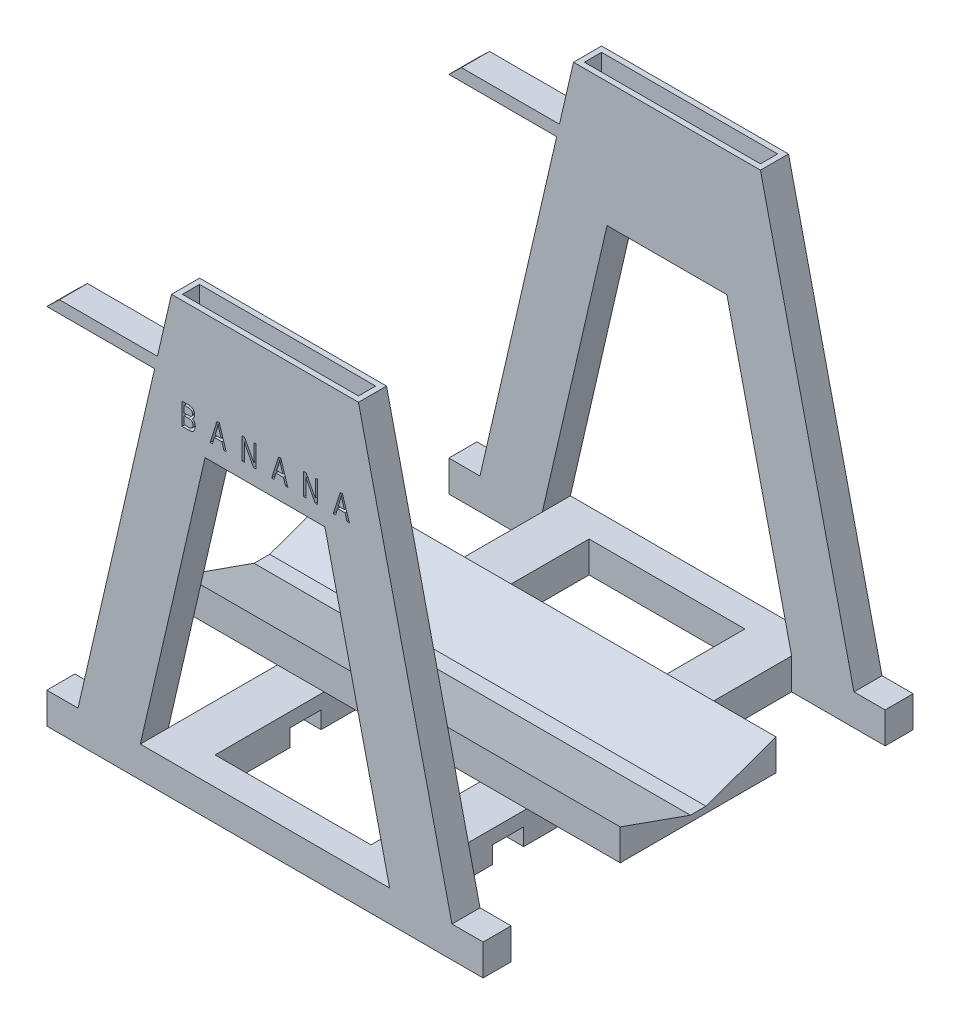
from build123d import *

# Parameters (mm, degrees)
BOSS_EXTRUDE1_DEPTH     = 9
SKETCH2_W               = 15
SKETCH2_H               = 10
BOSS_EXTRUDE2_DEPTH     = 120
SKETCH3_W               = 15
SKETCH3_H               = 10
BOSS_EXTRUDE3_DEPTH     = 9
SKETCH6_R               = 2
CUT_EXTRUDE3_DEPTH      = 226.264289225
SKETCH7_W               = 10
SKETCH7_H               = 5.5
CUT_EXTRUDE4_DEPTH      = 226.264289225
CUT_EXTRUDE5_DEPTH      = 209.671991412
WRAP1_DEPTH             = 2
WRAP2_START             = -2
WRAP2_DEPTH             = 2
BOSS_EXTRUDE6_START     = -70
BOSS_EXTRUDE6_OUTLINE_W = 3.897564783
BOSS_EXTRUDE6_OUTLINE_H = 9
BOSS_EXTRUDE6_DEPTH     = 35.502809866
CUT_EXTRUDE7_DEPTH      = 209.671991579
BOSS_EXTRUDE7_REACH     = 227.264
BOSS_EXTRUDE8_DEPTH     = 30
SKETCH19_W              = 56.5
SKETCH19_H              = 5.5
CUT_EXTRUDE9_DEPTH      = 25
SKETCH20_W              = 56.5
SKETCH20_H              = 5.5
CUT_EXTRUDE13_DEPTH     = 25


# Read off the part's stored shape, not the designer's step: Wrap1, Wrap2, Boss-Extrude6
with BuildPart() as part:
    # Sketch1 → Boss-Extrude1 (new body)
    with BuildSketch(Plane.XY):
        Polygon((-70, 0), (70, 0), (70, 10), (60, 10), (30, 140), (-30, 140), (-60, 10), (-70, 10), align=None)
    extrude(amount=BOSS_EXTRUDE1_DEPTH)

    # Sketch2 → Boss-Extrude2 (add)
    with BuildSketch(Plane.XY.offset(9)):
        with Locations((-32.5, 5)):
            Rectangle(SKETCH2_W, SKETCH2_H)
        with Locations((32.5, 5)):
            Rectangle(SKETCH2_W, SKETCH2_H)
    extrude(amount=BOSS_EXTRUDE2_DEPTH)

    # Sketch3 → Boss-Extrude3 (add)
    with BuildSketch(Plane.XY.offset(129)):
        Polygon((-25, 0), (70, 0), (70, 10), (60, 10), (30, 140), (-30, 140), (-60, 10), (-70, 10), (-70, 0), (-40, 0), (-40, 10), (-25, 10), align=None)
        with Locations((-32.5, 5)):
            Rectangle(SKETCH3_W, SKETCH3_H)
    extrude(amount=BOSS_EXTRUDE3_DEPTH)

    # Sketch6 → Cut-Extrude3 (cut, through all)
    with BuildSketch(Plane(origin=(40, 0, 0), x_dir=(0, 0, -1), z_dir=(1, 0, 0))):
        with Locations((-69, 5)):
            Circle(SKETCH6_R)
    extrude(amount=-CUT_EXTRUDE3_DEPTH, mode=Mode.SUBTRACT)

    # Sketch7 → Cut-Extrude4 (cut, through all)
    with BuildSketch(Plane(origin=(40, 0, 0), x_dir=(0, 0, -1), z_dir=(1, 0, 0))):
        with Locations((-38, 2.75)):
            Rectangle(SKETCH7_W, SKETCH7_H)
        with Locations((-100, 2.75)):
            Rectangle(SKETCH7_W, SKETCH7_H)
    extrude(amount=-CUT_EXTRUDE4_DEPTH, mode=Mode.SUBTRACT)

    # Sketch11 → Cut-Extrude5 (cut, through all)
    with BuildSketch(Plane.XY.offset(138)):
        Polygon((-40, 10), (40, 10), (19.230769231, 100), (-19.230769231, 100), align=None)
    extrude(amount=-CUT_EXTRUDE5_DEPTH, mode=Mode.SUBTRACT)

    # Wrap1 outline → Wrap1 (cut)
    # profile 1 of 6: a face of its own
    with BuildSketch(Plane(origin=(0, 0, 138), x_dir=(-1, 0, 0), z_dir=(0, 0, -1))):
        with BuildLine():
            Line((26.636363636, 112), (24.465909091, 112))
            add(Edge.make_bspline(
                [(24.465909091, 112), (24.412387075, 111.99961684), (24.308084537, 111.998870145), (24.155971868, 111.988392277), (24.01236608, 111.972961835), (23.877013252, 111.952268584), (23.750933524, 111.923725226), (23.633017031, 111.889788151), (23.523949716, 111.84855853), (23.389500433, 111.786579854), (23.234568973, 111.689336809), (23.065213144, 111.547084561), (22.917376343, 111.372957501), (22.785907176, 111.177315385), (22.678135608, 110.961409469), (22.60133372, 110.730947284), (22.554296617, 110.489122922), (22.548437341, 110.324077103), (22.545454545, 110.240056818)],
                knots=[0, 0, 0, 0, 0.054419901, 0.106052316, 0.154973079, 0.201283865, 0.245207579, 0.286348378, 0.325967571, 0.363667586, 0.436758257, 0.511236289, 0.587698946, 0.668228913, 0.750489374, 0.83225793, 0.914607129, 1, 1, 1, 1], degree=3))
            add(Edge.make_bspline(
                [(22.545454545, 110.240056818), (22.547820411, 110.162717247), (22.552466431, 110.01084), (22.591706687, 109.789343248), (22.656188718, 109.579438847), (22.745180341, 109.382599042), (22.857848847, 109.201013549), (22.992710329, 109.037889018), (23.148309744, 108.89208859), (23.266786112, 108.812817809), (23.326704545, 108.772727273)],
                knots=[0, 0, 0, 0, 0.133378671, 0.261925234, 0.386749065, 0.511436452, 0.633636329, 0.754357806, 0.87576851, 1, 1, 1, 1], degree=3))
            add(Edge.make_bspline(
                [(23.326704545, 108.772727273), (23.254763057, 108.739182942), (23.111508977, 108.672387519), (22.921317937, 108.528533457), (22.754966164, 108.353305411), (22.615115127, 108.146088993), (22.500551061, 107.910819976), (22.420423228, 107.647745575), (22.371380901, 107.359791359), (22.366279844, 107.159297888), (22.363636364, 107.055397727)],
                knots=[0, 0, 0, 0, 0.113495542, 0.22599893, 0.339269099, 0.458403399, 0.582828894, 0.712886569, 0.851211456, 1, 1, 1, 1], degree=3))
            add(Edge.make_bspline(
                [(22.363636364, 107.055397727), (22.366324034, 106.951030713), (22.37154717, 106.74820712), (22.42113518, 106.453821032), (22.501912451, 106.179404976), (22.613493409, 105.926555592), (22.752526978, 105.701256609), (22.912317795, 105.503739366), (23.097347849, 105.34245732), (23.269220741, 105.234205971), (23.419299179, 105.166999907), (23.541248423, 105.120730644), (23.67390787, 105.085231718), (23.815833139, 105.052942903), (23.968248577, 105.029578335), (24.130888416, 105.01313957), (24.30284115, 105.000704687), (24.420903914, 105.000239099), (24.481534091, 105)],
                knots=[0, 0, 0, 0, 0.092716759, 0.18018285, 0.264484475, 0.346454707, 0.425071031, 0.499228386, 0.571412375, 0.642308589, 0.678850615, 0.717473919, 0.758119917, 0.800806905, 0.846825339, 0.895074643, 0.946116432, 1, 1, 1, 1], degree=3))
            Line((24.481534091, 105), (26.636363636, 105))
            Line((26.636363636, 105), (26.636363636, 112))
        make_face()
        with BuildLine():
            Line((25.909090909, 105.818181818), (24.465909091, 105.818181818))
            add(Edge.make_bspline(
                [(24.465909091, 105.818181818), (24.391509772, 105.819003887), (24.252905111, 105.820535386), (24.060919078, 105.838197956), (23.898668145, 105.861633936), (23.804175313, 105.892338668), (23.761363636, 105.90625)],
                knots=[0, 0, 0, 0, 0.312794125, 0.582730111, 0.810948371, 1, 1, 1, 1], degree=3))
            add(Edge.make_bspline(
                [(23.761363636, 105.90625), (23.708766569, 105.929044678), (23.606147205, 105.973518172), (23.470666371, 106.070416615), (23.353302645, 106.185001445), (23.25769222, 106.322255543), (23.182512933, 106.478167407), (23.127956884, 106.652693961), (23.097684484, 106.845539387), (23.093222217, 106.980009846), (23.090909091, 107.049715909)],
                knots=[0, 0, 0, 0, 0.121040926, 0.236156568, 0.350259887, 0.466771973, 0.588247815, 0.715360694, 0.85245023, 1, 1, 1, 1], degree=3))
            add(Edge.make_bspline(
                [(23.090909091, 107.049715909), (23.092520525, 107.11473118), (23.095634469, 107.240367061), (23.127913823, 107.420705701), (23.178143249, 107.586234073), (23.251309853, 107.734631963), (23.341215024, 107.865308517), (23.443756476, 107.980219126), (23.563826113, 108.072833395), (23.674678792, 108.135845639), (23.773657093, 108.174991371), (23.857698714, 108.202857588), (23.952791264, 108.222435974), (24.056822898, 108.241628816), (24.170675524, 108.255499364), (24.294402347, 108.264718079), (24.42792834, 108.272821288), (24.520345787, 108.272759339), (24.568181818, 108.272727273)],
                knots=[0, 0, 0, 0, 0.088178288, 0.170396226, 0.247855459, 0.322311963, 0.39398617, 0.462693494, 0.530459225, 0.598949711, 0.63499805, 0.674841195, 0.718974832, 0.766637384, 0.818461465, 0.87456567, 0.935074158, 1, 1, 1, 1], degree=3))
            Line((24.568181818, 108.272727273), (25.909090909, 108.272727273))
            Line((25.909090909, 108.272727273), (25.909090909, 105.818181818))
        make_face(mode=Mode.SUBTRACT)
        with BuildLine():
            Line((25.909090909, 109.090909091), (24.625, 109.090909091))
            add(Edge.make_bspline(
                [(24.625, 109.090909091), (24.547305215, 109.091471035), (24.403632508, 109.092510178), (24.206636451, 109.106052608), (24.044251584, 109.122034002), (23.95056945, 109.146734226), (23.909090909, 109.157670455)],
                knots=[0, 0, 0, 0, 0.32310908, 0.597491268, 0.821785923, 1, 1, 1, 1], degree=3))
            add(Edge.make_bspline(
                [(23.909090909, 109.157670455), (23.860523188, 109.174971129), (23.765644038, 109.208768747), (23.63856712, 109.286125643), (23.527032639, 109.377238454), (23.434110435, 109.487675277), (23.36070045, 109.618015556), (23.308746833, 109.769018092), (23.277286655, 109.940463984), (23.274298456, 110.061408087), (23.272727273, 110.125)],
                knots=[0, 0, 0, 0, 0.123211508, 0.240699025, 0.354261293, 0.466953644, 0.584282288, 0.710551541, 0.84780919, 1, 1, 1, 1], degree=3))
            add(Edge.make_bspline(
                [(23.272727273, 110.125), (23.274757688, 110.184747451), (23.278647618, 110.299213393), (23.304834698, 110.464070028), (23.353388865, 110.612170099), (23.419337267, 110.744546465), (23.499822543, 110.85994), (23.594582416, 110.956938752), (23.703133609, 111.033451097), (23.804473833, 111.081051485), (23.895221466, 111.111901146), (23.976990165, 111.128844266), (24.070038236, 111.146809605), (24.176047393, 111.158138028), (24.293803654, 111.170567556), (24.424666694, 111.176645051), (24.56767469, 111.181133704), (24.667135175, 111.18158433), (24.71875, 111.181818182)],
                knots=[0, 0, 0, 0, 0.085947768, 0.16466129, 0.239182214, 0.309236985, 0.376694352, 0.44074799, 0.503295738, 0.566661331, 0.601121299, 0.640939433, 0.686627327, 0.737398252, 0.794189446, 0.856940807, 0.925759711, 1, 1, 1, 1], degree=3))
            Line((24.71875, 111.181818182), (25.909090909, 111.181818182))
            Line((25.909090909, 111.181818182), (25.909090909, 109.090909091))
        make_face(mode=Mode.SUBTRACT)
    # profile 2 of 6: a face of its own
    with BuildSketch(Plane(origin=(0, 0, 138), x_dir=(-1, 0, 0), z_dir=(0, 0, -1))):
        Polygon((15.382386364, 112), (14.673579545, 112), (12.436363636, 105), (13.192045455, 105), (13.804261364, 107.090909091), (16.250284091, 107.090909091), (16.861079545, 105), (17.618181818, 105), align=None)
        with BuildLine():
            Line((14.044318182, 107.909090909), (14.629545455, 109.832386364))
            add(Edge.make_bspline(
                [(14.629545455, 109.832386364), (14.651438953, 109.904322467), (14.694182819, 110.044767222), (14.75471203, 110.250421569), (14.812806318, 110.445480873), (14.862430034, 110.631305776), (14.9117749, 110.805478516), (14.954331489, 110.969937348), (14.992533119, 111.123866078), (15.015999872, 111.223462924), (15.027272727, 111.271306818)],
                knots=[0, 0, 0, 0, 0.15107397, 0.294949905, 0.430719323, 0.559959533, 0.68135738, 0.794417991, 0.90124342, 1, 1, 1, 1], degree=3))
            add(Edge.make_bspline(
                [(15.027272727, 111.271306818), (15.047737825, 111.159865362), (15.088640836, 110.937130488), (15.165311917, 110.605325607), (15.250610822, 110.27411948), (15.318505606, 110.055611064), (15.352556818, 109.946022727)],
                knots=[0, 0, 0, 0, 0.248875157, 0.49741971, 0.747941344, 1, 1, 1, 1], degree=3))
            Line((15.352556818, 109.946022727), (16.011647727, 107.909090909))
            Line((16.011647727, 107.909090909), (14.044318182, 107.909090909))
        make_face(mode=Mode.SUBTRACT)
    # profile 3 of 6: a face of its own
    with BuildSketch(Plane(origin=(0, 0, 138), x_dir=(-1, 0, 0), z_dir=(0, 0, -1))):
        Polygon((7.327272727, 112), (6.553125, 112), (3.6, 106.420454545), (3.6, 112), (2.872727273, 112), (2.872727273, 105), (3.651136364, 105), (6.6, 110.572443182), (6.6, 105), (7.327272727, 105), align=None)
    # profile 4 of 6: a face of its own
    with BuildSketch(Plane(origin=(0, 0, 138), x_dir=(-1, 0, 0), z_dir=(0, 0, -1))):
        Polygon((-4.38125, 112), (-5.090056818, 112), (-7.327272727, 105), (-6.571590909, 105), (-5.959375, 107.090909091), (-3.513352273, 107.090909091), (-2.902556818, 105), (-2.145454545, 105), align=None)
        with BuildLine():
            Line((-5.719318182, 107.909090909), (-5.134090909, 109.832386364))
            add(Edge.make_bspline(
                [(-5.134090909, 109.832386364), (-5.11219741, 109.904322467), (-5.069453545, 110.044767222), (-5.008924334, 110.250421569), (-4.950830046, 110.445480873), (-4.90120633, 110.631305776), (-4.851861464, 110.805478516), (-4.809304875, 110.969937348), (-4.771103245, 111.123866078), (-4.747636492, 111.223462924), (-4.736363636, 111.271306818)],
                knots=[0, 0, 0, 0, 0.15107397, 0.294949905, 0.430719323, 0.559959533, 0.68135738, 0.794417991, 0.90124342, 1, 1, 1, 1], degree=3))
            add(Edge.make_bspline(
                [(-4.736363636, 111.271306818), (-4.715898538, 111.159865362), (-4.674995528, 110.937130488), (-4.598324446, 110.605325607), (-4.513025542, 110.27411948), (-4.445130758, 110.055611064), (-4.411079545, 109.946022727)],
                knots=[0, 0, 0, 0, 0.248875157, 0.49741971, 0.747941344, 1, 1, 1, 1], degree=3))
            Line((-4.411079545, 109.946022727), (-3.751988636, 107.909090909))
            Line((-3.751988636, 107.909090909), (-5.719318182, 107.909090909))
        make_face(mode=Mode.SUBTRACT)
    # profile 5 of 6: a face of its own
    with BuildSketch(Plane(origin=(0, 0, 138), x_dir=(-1, 0, 0), z_dir=(0, 0, -1))):
        Polygon((-12.436363636, 112), (-13.210511364, 112), (-16.163636364, 106.420454545), (-16.163636364, 112), (-16.890909091, 112), (-16.890909091, 105), (-16.1125, 105), (-13.163636364, 110.572443182), (-13.163636364, 105), (-12.436363636, 105), align=None)
    # profile 6 of 6: a face of its own
    with BuildSketch(Plane(origin=(0, 0, 138), x_dir=(-1, 0, 0), z_dir=(0, 0, -1))):
        Polygon((-24.144886364, 112), (-24.853693182, 112), (-27.090909091, 105), (-26.335227273, 105), (-25.723011364, 107.090909091), (-23.276988636, 107.090909091), (-22.666193182, 105), (-21.909090909, 105), align=None)
        with BuildLine():
            Line((-25.482954545, 107.909090909), (-24.897727273, 109.832386364))
            add(Edge.make_bspline(
                [(-24.897727273, 109.832386364), (-24.875833774, 109.904322467), (-24.833089909, 110.044767222), (-24.772560698, 110.250421569), (-24.714466409, 110.445480873), (-24.664842693, 110.631305776), (-24.615497827, 110.805478516), (-24.572941239, 110.969937348), (-24.534739609, 111.123866078), (-24.511272856, 111.223462924), (-24.5, 111.271306818)],
                knots=[0, 0, 0, 0, 0.15107397, 0.294949905, 0.430719323, 0.559959533, 0.68135738, 0.794417991, 0.90124342, 1, 1, 1, 1], degree=3))
            add(Edge.make_bspline(
                [(-24.5, 111.271306818), (-24.479534902, 111.159865362), (-24.438631891, 110.937130488), (-24.36196081, 110.605325607), (-24.276661906, 110.27411948), (-24.208767121, 110.055611064), (-24.174715909, 109.946022727)],
                knots=[0, 0, 0, 0, 0.248875157, 0.49741971, 0.747941344, 1, 1, 1, 1], degree=3))
            Line((-24.174715909, 109.946022727), (-23.515625, 107.909090909))
            Line((-23.515625, 107.909090909), (-25.482954545, 107.909090909))
        make_face(mode=Mode.SUBTRACT)
    extrude(amount=WRAP1_DEPTH, mode=Mode.SUBTRACT)

    # Wrap2 outline → Wrap2 (cut)
    # profile 1 of 6: a face of its own
    with BuildSketch(Plane(origin=(0, 0, 0), x_dir=(-1, 0, 0), z_dir=(0, 0, -1)).offset(WRAP2_START)):
        with BuildLine():
            add(Edge.make_bspline(
                [(-24.465909091, 112), (-24.412387075, 111.99961684), (-24.308084537, 111.998870145), (-24.155971868, 111.988392277), (-24.01236608, 111.972961835), (-23.877013252, 111.952268584), (-23.750933524, 111.923725226), (-23.633017031, 111.889788151), (-23.523949716, 111.84855853), (-23.389500433, 111.786579854), (-23.234568973, 111.689336809), (-23.065213144, 111.547084561), (-22.917376343, 111.372957501), (-22.785907176, 111.177315385), (-22.678135608, 110.961409469), (-22.60133372, 110.730947284), (-22.554296617, 110.489122922), (-22.548437341, 110.324077103), (-22.545454545, 110.240056818)],
                knots=[0, 0, 0, 0, 0.054419901, 0.106052316, 0.154973079, 0.201283865, 0.245207579, 0.286348378, 0.325967571, 0.363667586, 0.436758257, 0.511236289, 0.587698946, 0.668228913, 0.750489374, 0.83225793, 0.914607129, 1, 1, 1, 1], degree=3))
            Line((-24.465909091, 112), (-26.636363636, 112))
            Line((-26.636363636, 112), (-26.636363636, 105))
            Line((-26.636363636, 105), (-24.481534091, 105))
            add(Edge.make_bspline(
                [(-22.363636364, 107.055397727), (-22.366324034, 106.951030713), (-22.37154717, 106.74820712), (-22.42113518, 106.453821032), (-22.501912451, 106.179404976), (-22.613493409, 105.926555592), (-22.752526978, 105.701256609), (-22.912317795, 105.503739366), (-23.097347849, 105.34245732), (-23.269220741, 105.234205971), (-23.419299179, 105.166999907), (-23.541248423, 105.120730644), (-23.67390787, 105.085231718), (-23.815833139, 105.052942903), (-23.968248577, 105.029578335), (-24.130888416, 105.01313957), (-24.30284115, 105.000704687), (-24.420903914, 105.000239099), (-24.481534091, 105)],
                knots=[0, 0, 0, 0, 0.092716759, 0.18018285, 0.264484475, 0.346454707, 0.425071031, 0.499228386, 0.571412375, 0.642308589, 0.678850615, 0.717473919, 0.758119917, 0.800806905, 0.846825339, 0.895074643, 0.946116432, 1, 1, 1, 1], degree=3))
            add(Edge.make_bspline(
                [(-23.326704545, 108.772727273), (-23.254763057, 108.739182942), (-23.111508977, 108.672387519), (-22.921317937, 108.528533457), (-22.754966164, 108.353305411), (-22.615115127, 108.146088993), (-22.500551061, 107.910819976), (-22.420423228, 107.647745575), (-22.371380901, 107.359791359), (-22.366279844, 107.159297888), (-22.363636364, 107.055397727)],
                knots=[0, 0, 0, 0, 0.113495542, 0.22599893, 0.339269099, 0.458403399, 0.582828894, 0.712886569, 0.851211456, 1, 1, 1, 1], degree=3))
            add(Edge.make_bspline(
                [(-22.545454545, 110.240056818), (-22.547820411, 110.162717247), (-22.552466431, 110.01084), (-22.591706687, 109.789343248), (-22.656188718, 109.579438847), (-22.745180341, 109.382599042), (-22.857848847, 109.201013549), (-22.992710329, 109.037889018), (-23.148309744, 108.89208859), (-23.266786112, 108.812817809), (-23.326704545, 108.772727273)],
                knots=[0, 0, 0, 0, 0.133378671, 0.261925234, 0.386749065, 0.511436452, 0.633636329, 0.754357806, 0.87576851, 1, 1, 1, 1], degree=3))
        make_face()
        with BuildLine():
            add(Edge.make_bspline(
                [(-24.465909091, 105.818181818), (-24.391509772, 105.819003887), (-24.252905111, 105.820535386), (-24.060919078, 105.838197956), (-23.898668145, 105.861633936), (-23.804175313, 105.892338668), (-23.761363636, 105.90625)],
                knots=[0, 0, 0, 0, 0.312794125, 0.582730111, 0.810948371, 1, 1, 1, 1], degree=3))
            Line((-24.465909091, 105.818181818), (-25.909090909, 105.818181818))
            Line((-25.909090909, 105.818181818), (-25.909090909, 108.272727273))
            Line((-25.909090909, 108.272727273), (-24.568181818, 108.272727273))
            add(Edge.make_bspline(
                [(-23.090909091, 107.049715909), (-23.092520525, 107.11473118), (-23.095634469, 107.240367061), (-23.127913823, 107.420705701), (-23.178143249, 107.586234073), (-23.251309853, 107.734631963), (-23.341215024, 107.865308517), (-23.443756476, 107.980219126), (-23.563826113, 108.072833395), (-23.674678792, 108.135845639), (-23.773657093, 108.174991371), (-23.857698714, 108.202857588), (-23.952791264, 108.222435974), (-24.056822898, 108.241628816), (-24.170675524, 108.255499364), (-24.294402347, 108.264718079), (-24.42792834, 108.272821288), (-24.520345787, 108.272759339), (-24.568181818, 108.272727273)],
                knots=[0, 0, 0, 0, 0.088178288, 0.170396226, 0.247855459, 0.322311963, 0.39398617, 0.462693494, 0.530459225, 0.598949711, 0.63499805, 0.674841195, 0.718974832, 0.766637384, 0.818461465, 0.87456567, 0.935074158, 1, 1, 1, 1], degree=3))
            add(Edge.make_bspline(
                [(-23.761363636, 105.90625), (-23.708766569, 105.929044678), (-23.606147205, 105.973518172), (-23.470666371, 106.070416615), (-23.353302645, 106.185001445), (-23.25769222, 106.322255543), (-23.182512933, 106.478167407), (-23.127956884, 106.652693961), (-23.097684484, 106.845539387), (-23.093222217, 106.980009846), (-23.090909091, 107.049715909)],
                knots=[0, 0, 0, 0, 0.121040926, 0.236156568, 0.350259887, 0.466771973, 0.588247815, 0.715360694, 0.85245023, 1, 1, 1, 1], degree=3))
        make_face(mode=Mode.SUBTRACT)
        with BuildLine():
            add(Edge.make_bspline(
                [(-24.625, 109.090909091), (-24.547305215, 109.091471035), (-24.403632508, 109.092510178), (-24.206636451, 109.106052608), (-24.044251584, 109.122034002), (-23.95056945, 109.146734226), (-23.909090909, 109.157670455)],
                knots=[0, 0, 0, 0, 0.32310908, 0.597491268, 0.821785923, 1, 1, 1, 1], degree=3))
            Line((-24.625, 109.090909091), (-25.909090909, 109.090909091))
            Line((-25.909090909, 109.090909091), (-25.909090909, 111.181818182))
            Line((-25.909090909, 111.181818182), (-24.71875, 111.181818182))
            add(Edge.make_bspline(
                [(-23.272727273, 110.125), (-23.274757688, 110.184747451), (-23.278647618, 110.299213393), (-23.304834698, 110.464070028), (-23.353388865, 110.612170099), (-23.419337267, 110.744546465), (-23.499822543, 110.85994), (-23.594582416, 110.956938752), (-23.703133609, 111.033451097), (-23.804473833, 111.081051485), (-23.895221466, 111.111901146), (-23.976990165, 111.128844266), (-24.070038236, 111.146809605), (-24.176047393, 111.158138028), (-24.293803654, 111.170567556), (-24.424666694, 111.176645051), (-24.56767469, 111.181133704), (-24.667135175, 111.18158433), (-24.71875, 111.181818182)],
                knots=[0, 0, 0, 0, 0.085947768, 0.16466129, 0.239182214, 0.309236985, 0.376694352, 0.44074799, 0.503295738, 0.566661331, 0.601121299, 0.640939433, 0.686627327, 0.737398252, 0.794189446, 0.856940807, 0.925759711, 1, 1, 1, 1], degree=3))
            add(Edge.make_bspline(
                [(-23.909090909, 109.157670455), (-23.860523188, 109.174971129), (-23.765644038, 109.208768747), (-23.63856712, 109.286125643), (-23.527032639, 109.377238454), (-23.434110435, 109.487675277), (-23.36070045, 109.618015556), (-23.308746833, 109.769018092), (-23.277286655, 109.940463984), (-23.274298456, 110.061408087), (-23.272727273, 110.125)],
                knots=[0, 0, 0, 0, 0.123211508, 0.240699025, 0.354261293, 0.466953644, 0.584282288, 0.710551541, 0.84780919, 1, 1, 1, 1], degree=3))
        make_face(mode=Mode.SUBTRACT)
    # profile 2 of 6: a face of its own
    with BuildSketch(Plane(origin=(0, 0, 0), x_dir=(-1, 0, 0), z_dir=(0, 0, -1)).offset(WRAP2_START)):
        Polygon((27.090909091, 105), (24.853693182, 112), (24.144886364, 112), (21.909090909, 105), (22.666193182, 105), (23.276988636, 107.090909091), (25.723011364, 107.090909091), (26.335227273, 105), align=None)
        with BuildLine():
            add(Edge.make_bspline(
                [(24.897727273, 109.832386364), (24.875833774, 109.904322467), (24.833089909, 110.044767222), (24.772560698, 110.250421569), (24.714466409, 110.445480873), (24.664842693, 110.631305776), (24.615497827, 110.805478516), (24.572941239, 110.969937348), (24.534739609, 111.123866078), (24.511272856, 111.223462924), (24.5, 111.271306818)],
                knots=[0, 0, 0, 0, 0.15107397, 0.294949905, 0.430719323, 0.559959533, 0.68135738, 0.794417991, 0.90124342, 1, 1, 1, 1], degree=3))
            Line((24.897727273, 109.832386364), (25.482954545, 107.909090909))
            Line((25.482954545, 107.909090909), (23.515625, 107.909090909))
            Line((23.515625, 107.909090909), (24.174715909, 109.946022727))
            add(Edge.make_bspline(
                [(24.5, 111.271306818), (24.479534902, 111.159865362), (24.438631891, 110.937130488), (24.36196081, 110.605325607), (24.276661906, 110.27411948), (24.208767121, 110.055611064), (24.174715909, 109.946022727)],
                knots=[0, 0, 0, 0, 0.248875157, 0.49741971, 0.747941344, 1, 1, 1, 1], degree=3))
        make_face(mode=Mode.SUBTRACT)
    # profile 3 of 6: a face of its own
    with BuildSketch(Plane(origin=(0, 0, 0), x_dir=(-1, 0, 0), z_dir=(0, 0, -1)).offset(WRAP2_START)):
        Polygon((16.163636364, 106.420454545), (13.210511364, 112), (12.436363636, 112), (12.436363636, 105), (13.163636364, 105), (13.163636364, 110.572443182), (16.1125, 105), (16.890909091, 105), (16.890909091, 112), (16.163636364, 112), align=None)
    # profile 4 of 6: a face of its own
    with BuildSketch(Plane(origin=(0, 0, 0), x_dir=(-1, 0, 0), z_dir=(0, 0, -1)).offset(WRAP2_START)):
        Polygon((7.327272727, 105), (5.090056818, 112), (4.38125, 112), (2.145454545, 105), (2.902556818, 105), (3.513352273, 107.090909091), (5.959375, 107.090909091), (6.571590909, 105), align=None)
        with BuildLine():
            add(Edge.make_bspline(
                [(5.134090909, 109.832386364), (5.11219741, 109.904322467), (5.069453545, 110.044767222), (5.008924334, 110.250421569), (4.950830046, 110.445480873), (4.90120633, 110.631305776), (4.851861464, 110.805478516), (4.809304875, 110.969937348), (4.771103245, 111.123866078), (4.747636492, 111.223462924), (4.736363636, 111.271306818)],
                knots=[0, 0, 0, 0, 0.15107397, 0.294949905, 0.430719323, 0.559959533, 0.68135738, 0.794417991, 0.90124342, 1, 1, 1, 1], degree=3))
            Line((5.134090909, 109.832386364), (5.719318182, 107.909090909))
            Line((5.719318182, 107.909090909), (3.751988636, 107.909090909))
            Line((3.751988636, 107.909090909), (4.411079545, 109.946022727))
            add(Edge.make_bspline(
                [(4.736363636, 111.271306818), (4.715898538, 111.159865362), (4.674995528, 110.937130488), (4.598324446, 110.605325607), (4.513025542, 110.27411948), (4.445130758, 110.055611064), (4.411079545, 109.946022727)],
                knots=[0, 0, 0, 0, 0.248875157, 0.49741971, 0.747941344, 1, 1, 1, 1], degree=3))
        make_face(mode=Mode.SUBTRACT)
    # profile 5 of 6: a face of its own
    with BuildSketch(Plane(origin=(0, 0, 0), x_dir=(-1, 0, 0), z_dir=(0, 0, -1)).offset(WRAP2_START)):
        Polygon((-3.6, 106.420454545), (-6.553125, 112), (-7.327272727, 112), (-7.327272727, 105), (-6.6, 105), (-6.6, 110.572443182), (-3.651136364, 105), (-2.872727273, 105), (-2.872727273, 112), (-3.6, 112), align=None)
    # profile 6 of 6: a face of its own
    with BuildSketch(Plane(origin=(0, 0, 0), x_dir=(-1, 0, 0), z_dir=(0, 0, -1)).offset(WRAP2_START)):
        Polygon((-12.436363636, 105), (-14.673579545, 112), (-15.382386364, 112), (-17.618181818, 105), (-16.861079545, 105), (-16.250284091, 107.090909091), (-13.804261364, 107.090909091), (-13.192045455, 105), align=None)
        with BuildLine():
            add(Edge.make_bspline(
                [(-14.629545455, 109.832386364), (-14.651438953, 109.904322467), (-14.694182819, 110.044767222), (-14.75471203, 110.250421569), (-14.812806318, 110.445480873), (-14.862430034, 110.631305776), (-14.9117749, 110.805478516), (-14.954331489, 110.969937348), (-14.992533119, 111.123866078), (-15.015999872, 111.223462924), (-15.027272727, 111.271306818)],
                knots=[0, 0, 0, 0, 0.15107397, 0.294949905, 0.430719323, 0.559959533, 0.68135738, 0.794417991, 0.90124342, 1, 1, 1, 1], degree=3))
            Line((-14.629545455, 109.832386364), (-14.044318182, 107.909090909))
            Line((-14.044318182, 107.909090909), (-16.011647727, 107.909090909))
            Line((-16.011647727, 107.909090909), (-15.352556818, 109.946022727))
            add(Edge.make_bspline(
                [(-15.027272727, 111.271306818), (-15.047737825, 111.159865362), (-15.088640836, 110.937130488), (-15.165311917, 110.605325607), (-15.250610822, 110.27411948), (-15.318505606, 110.055611064), (-15.352556818, 109.946022727)],
                knots=[0, 0, 0, 0, 0.248875157, 0.49741971, 0.747941344, 1, 1, 1, 1], degree=3))
        make_face(mode=Mode.SUBTRACT)
    extrude(amount=WRAP2_DEPTH, mode=Mode.SUBTRACT)

    # Boss-Extrude6 outline → Boss-Extrude6 (add)
    with BuildSketch(Plane.YZ.offset(BOSS_EXTRUDE6_START)):
        with Locations((118.563393695, 133.5)):
            Rectangle(BOSS_EXTRUDE6_OUTLINE_W, BOSS_EXTRUDE6_OUTLINE_H)
    boss_extrude6 = extrude(amount=BOSS_EXTRUDE6_DEPTH)

    # Sketch17 → Cut-Extrude7 (cut, through all)
    with BuildSketch(Plane.XY.offset(138)):
        Polygon((-70, 116.614611303), (-65.963953517, 120.512176086), (-70, 120.512176086), align=None)
    cut_extrude7 = extrude(amount=-CUT_EXTRUDE7_DEPTH, mode=Mode.SUBTRACT)

    # Mirror1: Boss-Extrude6, Cut-Extrude7 across plane
    add(boss_extrude6.mirror(Plane(origin=(0, 0, 69), x_dir=(1, 0, 0), z_dir=(0, 0, -1))))
    add(cut_extrude7.mirror(Plane(origin=(0, 0, 69), x_dir=(1, 0, 0), z_dir=(0, 0, -1))), mode=Mode.SUBTRACT)

    # Boss-Extrude7: up to this face of the body (flat: up to its plane)
    boss_extrude7_end = Plane(part.part.faces().sort_by_distance((-70, 5, 133.5))[0])
    # Sketch18 → Boss-Extrude7 (add, up to the picked face)
    with BuildSketch(Plane(origin=(40, 0, 0), x_dir=(0, 0, -1), z_dir=(1, 0, 0)), mode=Mode.PRIVATE) as boss_extrude7_sk1:
        Polygon((-94, 10), (-94, 20), (-71.5, 12), (-66.5, 12), (-44, 20), (-44, 10), align=None)
    boss_extrude7_tool1 = split(extrude(boss_extrude7_sk1.sketch, amount=-BOSS_EXTRUDE7_REACH, mode=Mode.PRIVATE), bisect_by=boss_extrude7_end, keep=Keep.BOTH, mode=Mode.PRIVATE)
    add(boss_extrude7_tool1.solids().sort_by(Axis((40, 15, 93.490098), (-1, 0, 0)))[0])

    # Sketch18<3> → Boss-Extrude8 (add)
    with BuildSketch(Plane(origin=(40, 0, 0), x_dir=(0, 0, -1), z_dir=(1, 0, 0))):
        Polygon((-94, 10), (-94, 20), (-71.5, 12), (-66.5, 12), (-44, 20), (-44, 10), align=None)
    extrude(amount=BOSS_EXTRUDE8_DEPTH)

    # Sketch19 → Cut-Extrude9 (cut)
    with BuildSketch(Plane(origin=(0, 140, 0), x_dir=(1, 0, 0), z_dir=(0, 1, 0))):
        with Locations((0, -4.5)):
            Rectangle(SKETCH19_W, SKETCH19_H)
    extrude(amount=-CUT_EXTRUDE9_DEPTH, mode=Mode.SUBTRACT)

    # Sketch20 → Cut-Extrude13 (cut)
    with BuildSketch(Plane(origin=(0, 140, 0), x_dir=(1, 0, 0), z_dir=(0, 1, 0))):
        with Locations((0, -133.5)):
            Rectangle(SKETCH20_W, SKETCH20_H)
    extrude(amount=-CUT_EXTRUDE13_DEPTH, mode=Mode.SUBTRACT)


solid = part.part
